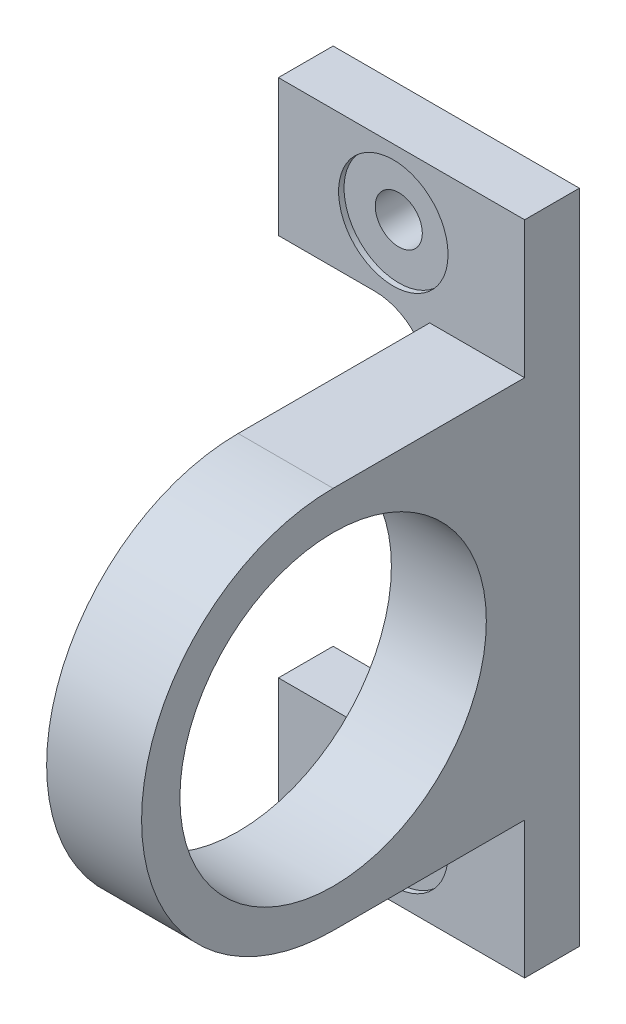
from build123d import *

# Parameters (mm, degrees)
SKETCH_2_W                     = 45
SKETCH_2_H                     = 60
SKETCH_2_W_2                   = 27.647058823
SKETCH_2_H_2                   = 35
EXTRUDE_2_DEPTH                = 5
SKETCH_4_W                     = 8.676470589
SKETCH_4_H                     = 35
SKETCH_4_W_2                   = 8.676470588
EXTRUDE_15_DEPTH               = 35
CUT_EXTRUDE_1_DEPTH            = 45
SKETCH_6_R                     = 14
CUT_EXTRUDE_2_DEPTH            = 45
FILLET_1_R                     = 5
SKETCH_7_R                     = 15
SKETCH_7_R_2                   = 13
EXTRUDE_16_DEPTH               = 1
SPLIT_BODIES_1_SURFACE_1_BACK  = 86
SPLIT_BODIES_1_SURFACE_1_DEPTH = 172
SPLIT_BODIES_1_SURFACE_2_BACK  = 86
SPLIT_BODIES_1_SURFACE_2_DEPTH = 172
HOLE_WIZARD_1_D                = 4.3
HOLE_WIZARD_1_DEPTH            = 5
HOLE_WIZARD_1_CBORE_D          = 10
HOLE_WIZARD_1_CBORE_DEPTH      = 0.5
HOLE_WIZARD_1_TIP              = 1.291850331


with BuildPart() as part:
    # 草图2 → 凸台-拉伸2 (new body)
    with BuildSketch(Plane.XY):
        with Locations((7.726423565, -5.661764706)):
            Rectangle(SKETCH_2_W, SKETCH_2_H)
        with Locations((7.726423565, -5.661764706)):
            Rectangle(SKETCH_2_W_2, SKETCH_2_H_2, mode=Mode.SUBTRACT)
    extrude(amount=EXTRUDE_2_DEPTH)

    # 草图4 → 凸台-拉伸15 (add)
    with BuildSketch(Plane.XY.offset(5)):
        with Locations((-10.435341141, -5.661764706)):
            Rectangle(SKETCH_4_W, SKETCH_4_H)
        with Locations((25.888188271, -5.661764706)):
            Rectangle(SKETCH_4_W_2, SKETCH_4_H)
    extrude(amount=EXTRUDE_15_DEPTH)

    # 草图5 → 切除-拉伸1 (cut)
    with BuildSketch(Plane.ZY.offset(14.773576435)):
        with BuildLine():
            ThreePointArc((22.5, 11.838235294), (34.874368671, 6.712603965), (40, -5.661764706))
            Line((40, -5.661764706), (40, 11.838235294))
            Line((40, 11.838235294), (22.5, 11.838235294))
        make_face()
        with BuildLine():
            Line((40, -23.161764706), (40, -5.661764706))
            ThreePointArc((40, -5.661764706), (34.874368671, -18.036133377), (22.5, -23.161764706))
            Line((22.5, -23.161764706), (40, -23.161764706))
        make_face()
    extrude(amount=-CUT_EXTRUDE_1_DEPTH, mode=Mode.SUBTRACT)

    # 草图6 → 切除-拉伸2 (cut)
    with BuildSketch(Plane.ZY.offset(14.773576435)):
        with Locations((22.5, -5.661764706)):
            Circle(SKETCH_6_R)
    extrude(amount=-CUT_EXTRUDE_2_DEPTH, mode=Mode.SUBTRACT)

    # 圆角1
    fillet_1_edges = [part.edges().sort_by_distance(p)[0] for p in [
        (-6.097105846, 11.838235294, 2.5),
        (21.549952977, 11.838235294, 2.5),
        (-6.097105846, -23.161764706, 2.5),
        (21.549952977, -23.161764706, 2.5),
    ]]
    fillet(fillet_1_edges, radius=FILLET_1_R)

    # 草图7 → 凸台-拉伸16 (add)
    with BuildSketch(Plane(origin=(-6.097105846, 0, 0), x_dir=(0, 0, -1), z_dir=(1, 0, 0))):
        with Locations((-22.5, -5.661764706)):
            Circle(SKETCH_7_R)
        with Locations((-22.5, -5.661764706)):
            Circle(SKETCH_7_R_2, mode=Mode.SUBTRACT)
    extrude(amount=-EXTRUDE_16_DEPTH)


with BuildPart() as body_2:
    # Split Bodies 1: the piece behind the surface
    add(part.part)
    # Split Bodies 1 surface: a surface, the sketch's curves swept straight by 172 mm
    with BuildLine(Plane.XY.offset(5).offset(-SPLIT_BODIES_1_SURFACE_1_BACK), mode=Mode.PRIVATE) as split_bodies_1_surface_1_path:
        Line((7.726423565, 24.338235294), (7.726423565, -35.661764706))
    split_bodies_1_surface_1 = Shell.extrude(split_bodies_1_surface_1_path.wire(), (0 * SPLIT_BODIES_1_SURFACE_1_DEPTH, 0 * SPLIT_BODIES_1_SURFACE_1_DEPTH, 1 * SPLIT_BODIES_1_SURFACE_1_DEPTH))
    split(bisect_by=split_bodies_1_surface_1, keep=Keep.BOTTOM)


with BuildPart() as part_1:
    add(part.part)

    # Split Bodies 1: split by a surface, the side it looks to stays
    # Split Bodies 1 surface: a surface, the sketch's curves swept straight by 172 mm
    with BuildLine(Plane.XY.offset(5).offset(-SPLIT_BODIES_1_SURFACE_2_BACK), mode=Mode.PRIVATE) as split_bodies_1_surface_2_path:
        Line((7.726423565, 24.338235294), (7.726423565, -35.661764706))
    split_bodies_1_surface_2 = Shell.extrude(split_bodies_1_surface_2_path.wire(), (0 * SPLIT_BODIES_1_SURFACE_2_DEPTH, 0 * SPLIT_BODIES_1_SURFACE_2_DEPTH, 1 * SPLIT_BODIES_1_SURFACE_2_DEPTH))
    split(bisect_by=split_bodies_1_surface_2, keep=Keep.TOP)

    # 打孔尺寸(%根据六角头螺)栓 全螺纹的类型1
    with Locations(Plane(origin=(18.226423565, 18.088235294, 5), x_dir=(1, 0, 0), z_dir=(0, 0, 1))):
        with Locations((0, 0), (0, -47.5)):
            CounterBoreHole(HOLE_WIZARD_1_D / 2, HOLE_WIZARD_1_CBORE_D / 2, HOLE_WIZARD_1_CBORE_DEPTH, depth=HOLE_WIZARD_1_DEPTH)
            with Locations((0, 0, -(HOLE_WIZARD_1_DEPTH + HOLE_WIZARD_1_TIP / 2))):  # 118° drill point
                Cone(0, HOLE_WIZARD_1_D / 2, HOLE_WIZARD_1_TIP, mode=Mode.SUBTRACT)


solid = part_1.part
